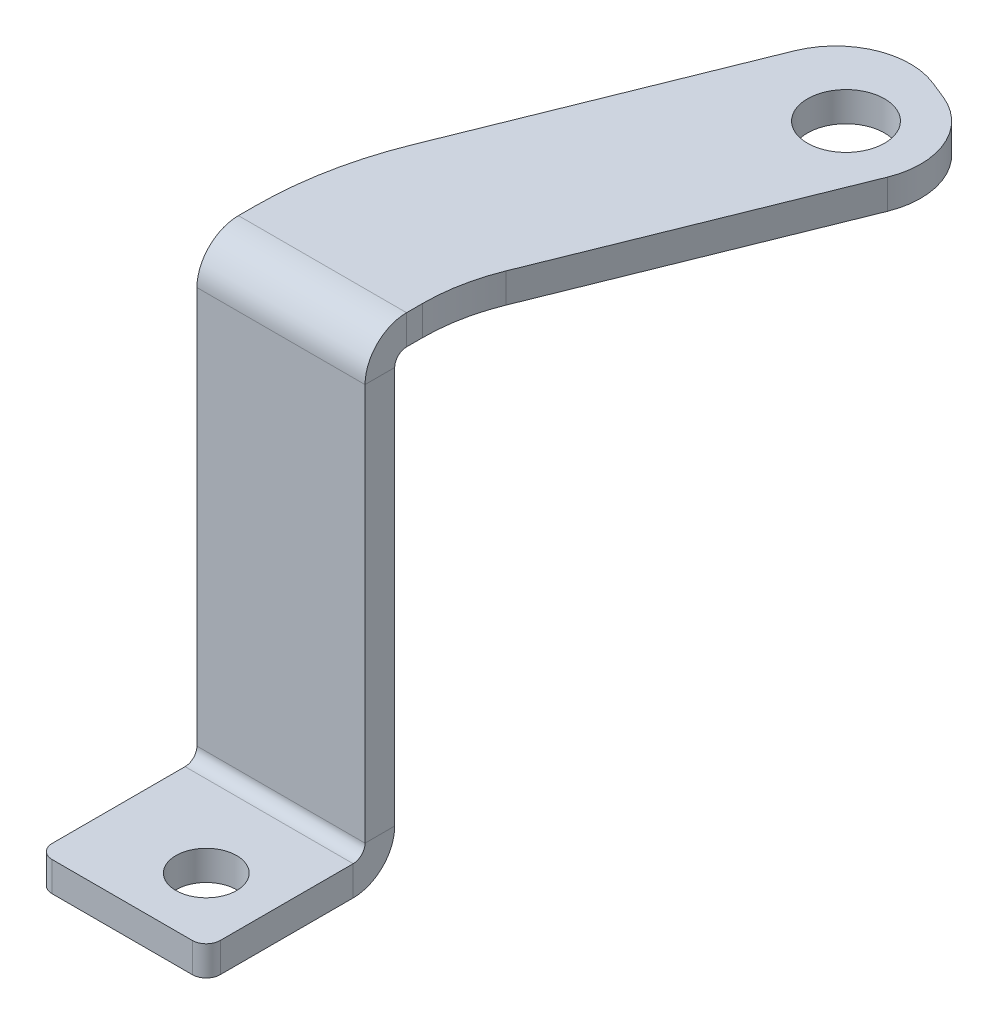
from build123d import *

# Parameters (mm, degrees)
SKETCH1_R                    = 3.25
BASE_FLANGE1_DEPTH           = 3.175
EDGE_FLANGE1_STRIP_W         = 15.24
EDGE_FLANGE1_STRIP_H         = 3.175
EDGE_FLANGE1_STRIP_CUT_DEPTH = 18
EDGE_FLANGE1_DEPTH           = 18
EDGE_FLANGE2_STRIP_W         = 15.24
EDGE_FLANGE2_STRIP_H         = 3.175
EDGE_FLANGE2_STRIP_CUT_DEPTH = 18
EDGE_FLANGE2_DEPTH           = 18
SKETCH12_R                   = 4.125
BOSS_EXTRUDE1_DEPTH          = 3.175


# Sheet-metal steps are written as plain solids
with BuildPart() as part:
    # Sketch1 → Base-Flange1 (new body)
    with BuildSketch(Plane(origin=(0, 0, 0), x_dir=(1, 0, 0), z_dir=(0, 1, 0))):
        with BuildLine():
            Line((7, -5.5), (7, 10))
            Line((7, 10), (-11, 10))
            Line((-11, 10), (-11, -5.5))
            ThreePointArc((-11, -5.5), (-10.560660172, -6.560660172), (-9.5, -7))
            Line((-9.5, -7), (5.5, -7))
            ThreePointArc((5.5, -7), (6.560660172, -6.560660172), (7, -5.5))
        make_face()
        with Locations(Location((0, 0, 0), (0, 0, 270))):
            Circle(SKETCH1_R, mode=Mode.SUBTRACT)
    extrude(amount=-BASE_FLANGE1_DEPTH)

    # Edge-Flange1 strip (across the edge) → Edge-Flange1 strip cut (cut)
    with BuildSketch(Plane(origin=(7, 0, -10), x_dir=(0, 0, 1), z_dir=(-1, 0, 0))):
        with Locations((-6.35, -1.5875)):
            Rectangle(EDGE_FLANGE1_STRIP_W, EDGE_FLANGE1_STRIP_H)
    extrude(amount=EDGE_FLANGE1_STRIP_CUT_DEPTH, mode=Mode.SUBTRACT)

    # Edge-Flange1 section (across the edge) → Edge-Flange1 (add)
    with BuildSketch(Plane(origin=(7, 0, -10), x_dir=(0, 0, 1), z_dir=(-1, 0, 0))):
        with BuildLine():
            Line((-3.175, 1.27), (-3.175, 45.0625))
            Line((-3.175, 45.0625), (0, 45.0625))
            Line((0, 45.0625), (0, 1.27))
            ThreePointArc((0, 1.27), (0.371974388, 0.371974388), (1.27, 0))
            Line((1.27, 0), (1.27, -3.175))
            ThreePointArc((1.27, -3.175), (-1.873089642, -1.873089642), (-3.175, 1.27))
        make_face()
    extrude(amount=EDGE_FLANGE1_DEPTH)

    # Edge-Flange2 strip (across the edge) → Edge-Flange2 strip cut (cut)
    with BuildSketch(Plane(origin=(-11, 45.0625, -13.175), x_dir=(0, -1, 0), z_dir=(1, 0, 0))):
        with Locations((-6.35, -1.5875)):
            Rectangle(EDGE_FLANGE2_STRIP_W, EDGE_FLANGE2_STRIP_H)
    extrude(amount=EDGE_FLANGE2_STRIP_CUT_DEPTH, mode=Mode.SUBTRACT)

    # Edge-Flange2 section (across the edge) → Edge-Flange2 (add)
    with BuildSketch(Plane(origin=(-11, 45.0625, -13.175), x_dir=(0, -1, 0), z_dir=(1, 0, 0))):
        with BuildLine():
            Line((-3.175, 1.27), (-3.175, 3))
            Line((-3.175, 3), (0, 3))
            Line((0, 3), (0, 1.27))
            ThreePointArc((0, 1.27), (0.371974388, 0.371974388), (1.27, 0))
            Line((1.27, 0), (1.27, -3.175))
            ThreePointArc((1.27, -3.175), (-1.873089642, -1.873089642), (-3.175, 1.27))
        make_face()
    extrude(amount=EDGE_FLANGE2_DEPTH)

    # Sketch12 → Boss-Extrude1 (add)
    with BuildSketch(Plane(origin=(0, 48.2375, 0), x_dir=(1, 0, 0), z_dir=(0, 1, 0))):
        with BuildLine():
            Line((7, 16.175), (-11, 16.175))
            ThreePointArc((-11, 16.175), (-10.306151754, 23.403488178), (-8.249945193, 30.368004048))
            Line((-8.249945193, 30.368004048), (3.473693159, 59.484997741))
            ThreePointArc((3.473693159, 59.484997741), (7.760101436, 63.857301034), (13.882735104, 63.918037982))
            Line((13.882735104, 63.918037982), (15.737995377, 63.171037769))
            ThreePointArc((15.737995377, 63.171037769), (20.11029867, 58.884629492), (20.171035618, 52.761995824))
            Line((20.171035618, 52.761995824), (8.447397267, 23.64500213))
            ThreePointArc((8.447397267, 23.64500213), (7.365183288, 19.979467462), (7, 16.175))
        make_face()
        with Locations(Location((12.749994525, 55.749996676, 0), (0, 0, 270))):
            Circle(SKETCH12_R, mode=Mode.SUBTRACT)
    extrude(amount=-BOSS_EXTRUDE1_DEPTH)


solid = part.part
